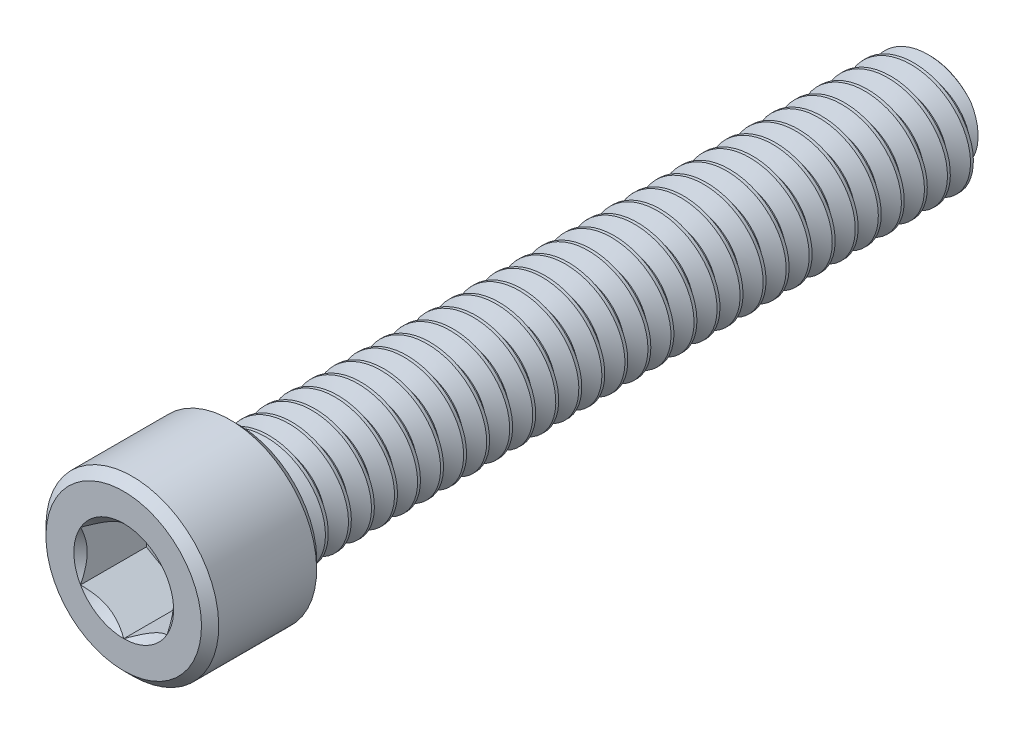
from build123d import *

# Parameters (mm, degrees)
CUT_EXTRUDE1_DEPTH = 3.628571429
CUT_SWEEP1_PITCH   = 1.27


# Read off the part's stored shape, not the designer's step: Split1
with BuildPart() as part:
    # Sketch2 → Revolve1 (revolve)
    with BuildSketch(Plane(origin=(0, 0, 0), x_dir=(0, 0, -1), z_dir=(1, 0, 0)), mode=Mode.PRIVATE) as revolve1_sk:
        Polygon((38.1, 2.8575), (37.7825, 3.175), (0, 3.175), (0, 4.28625), (-0.47625, 4.7625), (-5.87375, 4.7625), (-6.35, 4.28625), (-6.35, 2.38125), (-2.721428571, 2.38125), (-2.721428571, 0), (38.1, 0), align=None)
    revolve(revolve1_sk.sketch.rotate(Axis((0, 0, 2.721428571), (0, 0, -1)), 180), axis=Axis((0, 0, 2.721428571), (0, 0, -1)))

    # Sketch3 → Cut-Extrude1 (cut)
    with BuildSketch(Plane.XY.offset(6.35)):
        Polygon((0, 2.749630657), (-2.38125, 1.374815329), (-2.38125, -1.374815329), (0, -2.749630657), (2.38125, -1.374815329), (2.38125, 1.374815329), align=None)
    extrude(amount=-CUT_EXTRUDE1_DEPTH, mode=Mode.SUBTRACT)

    # Cut-Extrude2 cone 1 section (through the dimple's axis) → Cut-Extrude2 (revolve, cut)
    with BuildSketch(Plane(origin=(0, 0, 6.35), x_dir=(0, -1, 0), z_dir=(1, 0, 0))):
        Polygon((0, 0), (2.749630657, 0), (0, 2.749630657), align=None)
    revolve(axis=Axis((0, 0, 6.35), (0, 0, -1)), mode=Mode.SUBTRACT)


with BuildPart() as body_2:
    # Split1: the piece on the far side of the plane
    add(part.part)
    split(bisect_by=Plane.XY, keep=Keep.BOTTOM)

    # Cut-Sweep1: the profile of Sketch7 screwed along a right-hand helix of 31 turns, 8 arcs to a turn; built about Z, then put on its axis
    cut_sweep1_z = Axis((0, 0, 0), (0, 0, 1))
    cut_sweep1_corners = [(3.243740766, 0, -1.1509375), (3.312481533, 0, 0.079375), (2.350110803, 0, -0.47625), (2.350110803, 0, -0.635)]
    with BuildLine(mode=Mode.PRIVATE) as cut_sweep1_profile:
        Line(cut_sweep1_corners[0], cut_sweep1_corners[1])
        Line(cut_sweep1_corners[1], cut_sweep1_corners[2])
        Line(cut_sweep1_corners[2], cut_sweep1_corners[3])
        Line(cut_sweep1_corners[3], cut_sweep1_corners[0])
    cut_sweep1_cap = Face(cut_sweep1_profile.wire())
    cut_sweep1_turn_angles = [0, 22.5, 45, 67.5, 90, 112.5, 135, 157.5, 180, 202.5, 225, 247.5, 270, 292.5, 315, 337.5, 360]
    cut_sweep1_turn_weights = [1, 0.9238795325112867, 1, 0.9238795325112867, 1, 0.9238795325112867, 1, 0.9238795325112867, 1, 0.9238795325112867, 1, 0.9238795325112867, 1, 0.9238795325112867, 1, 0.9238795325112867, 1]
    cut_sweep1_turn_rails = [Edge.make_bspline([Vector(p[0], p[1], 0).rotate(cut_sweep1_z, cut_sweep1_turn_angles[k]) / cut_sweep1_turn_weights[k] + Vector(0, 0, p[2] + CUT_SWEEP1_PITCH * cut_sweep1_turn_angles[k] / 360) for k in range(17)], [0, 0, 0, 1, 1, 2, 2, 3, 3, 4, 4, 5, 5, 6, 6, 7, 7, 8, 8, 8], 2, cut_sweep1_turn_weights) for p in cut_sweep1_corners]
    cut_sweep1_turn_sides = [Face.make_surface_from_curves(cut_sweep1_turn_rails[p[0]], cut_sweep1_turn_rails[p[1]]) for p in [(0, 1), (1, 2), (2, 3), (3, 0)]]
    cut_sweep1 = Plane(origin=(0, 0, 0), x_dir=(0, 1, 0), z_dir=(0, 0, -1)) * Solid(Shell([*[p.moved(Location((0, 0, CUT_SWEEP1_PITCH * i))) for i in range(31) for p in cut_sweep1_turn_sides], cut_sweep1_cap, cut_sweep1_cap.rotate(cut_sweep1_z, 11160).moved(Location((0, 0, CUT_SWEEP1_PITCH * 11160 / 360)))]))
    add(cut_sweep1, mode=Mode.SUBTRACT)


with BuildPart() as part_1:
    add(part.part)

    # Split1
    split(bisect_by=Plane.XY, keep=Keep.TOP)

    # Combine1: union body 2
    add(body_2.part)


solid = part_1.part
